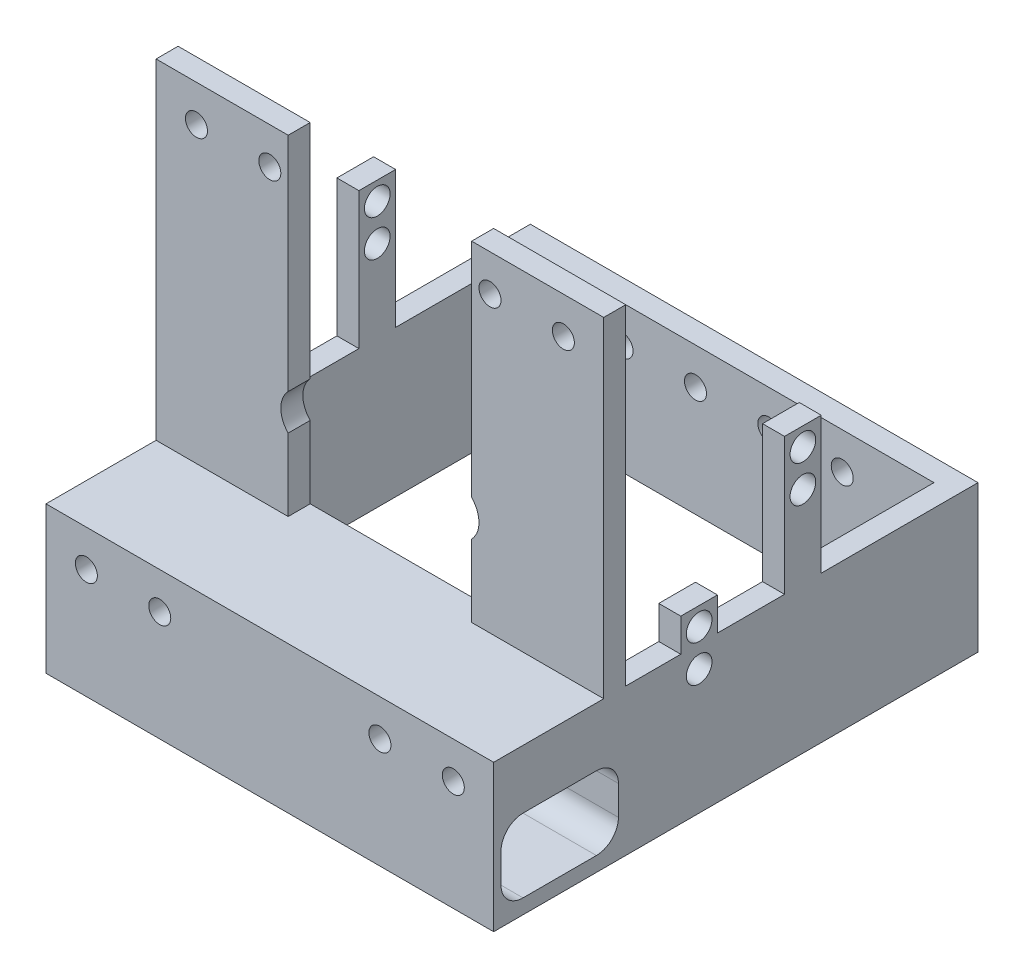
from build123d import *
from build123d.topology import SkipClean

# Parameters (mm, degrees)
SKETCH1_W           = 55
SKETCH1_H           = 10
SKETCH1_R           = 1.5
BOSS_EXTRUDE1_DEPTH = 15
BOSS_EXTRUDE2_START = 3
SKETCH2_R           = 1.5
BOSS_EXTRUDE2_DEPTH = 3
SKETCH3_W           = 55
SKETCH3_H           = 18
BOSS_EXTRUDE3_DEPTH = 10
BOSS_EXTRUDE5_DEPTH = 3
BOSS_EXTRUDE6_DEPTH = 3
CUT_EXTRUDE2_DEPTH  = 84.492514635
SKETCH10_W          = 3
SKETCH10_H          = 20
BOSS_EXTRUDE7_DEPTH = 45
SKETCH11_R          = 1.75
CUT_EXTRUDE3_DEPTH  = 96.131487952
SKETCH12_W          = 5
SKETCH12_H          = 18.64
SKETCH12_R          = 1.75
SKETCH12_H_2        = 4.5
BOSS_EXTRUDE8_DEPTH = 3
BOSS_EXTRUDE9_START = 3
SKETCH13_W          = 61
SKETCH13_H          = 20
SKETCH13_R          = 1.5
BOSS_EXTRUDE9_DEPTH = 3


with BuildPart() as part:
    # Sketch1 → Boss-Extrude1 (new body)
    with BuildSketch(Plane.XY):
        with Locations((-27.5, 5)):
            Rectangle(SKETCH1_W, SKETCH1_H)
        with Locations((-2.5, 5)):
            Circle(SKETCH1_R, mode=Mode.SUBTRACT)
        with Locations((-12.5, 5)):
            Circle(SKETCH1_R, mode=Mode.SUBTRACT)
        with Locations((-42.5, 5)):
            Circle(SKETCH1_R, mode=Mode.SUBTRACT)
        with Locations((-52.5, 5)):
            Circle(SKETCH1_R, mode=Mode.SUBTRACT)
    extrude(amount=BOSS_EXTRUDE1_DEPTH)

    # Sketch2 → Boss-Extrude2 (add)
    with SkipClean():  # the faces are left unmerged after this step: merging them gives an invalid solid
        with BuildSketch(Plane(origin=(0, 0, 0), x_dir=(-1, 0, 0), z_dir=(0, 0, -1)).offset(BOSS_EXTRUDE2_START)):
            with BuildLine():
                Line((0, 0), (55, 0))
                Line((55, 0), (55, 55))
                Line((55, 55), (40, 55))
                Line((40, 55), (40, 24.74951996))
                ThreePointArc((40, 24.74951996), (41, 22.300030217), (40, 19.850540474))
                Line((40, 19.850540474), (40, 10))
                Line((40, 10), (15, 10))
                Line((15, 10), (15, 19.850540474))
                ThreePointArc((15, 19.850540474), (14, 22.300030217), (15, 24.74951996))
                Line((15, 24.74951996), (15, 55))
                Line((15, 55), (0, 55))
                Line((0, 55), (0, 0))
            make_face()
            with Locations((2.5, 5)):
                Circle(SKETCH2_R, mode=Mode.SUBTRACT)
            with Locations((12.5, 5)):
                Circle(SKETCH2_R, mode=Mode.SUBTRACT)
            with Locations((12.5, 50)):
                Circle(SKETCH2_R, mode=Mode.SUBTRACT)
            with Locations((2.5, 50)):
                Circle(SKETCH2_R, mode=Mode.SUBTRACT)
            with Locations((52.5, 5)):
                Circle(SKETCH2_R, mode=Mode.SUBTRACT)
            with Locations((42.5, 5)):
                Circle(SKETCH2_R, mode=Mode.SUBTRACT)
            with Locations((52.5, 50)):
                Circle(SKETCH2_R, mode=Mode.SUBTRACT)
            with Locations((42.5, 50)):
                Circle(SKETCH2_R, mode=Mode.SUBTRACT)
        extrude(amount=-BOSS_EXTRUDE2_DEPTH)

    # Sketch3 → Boss-Extrude3 (add)
    with SkipClean():  # the faces are left unmerged after this step: merging them gives an invalid solid
        with BuildSketch(Plane.XZ):
            with Locations((-27.5, 6)):
                Rectangle(SKETCH3_W, SKETCH3_H)
        extrude(amount=BOSS_EXTRUDE3_DEPTH)

    # Sketch6 → Boss-Extrude5 (add)
    with SkipClean():  # the faces are left unmerged after this step: merging them gives an invalid solid
        with BuildSketch(Plane(origin=(0, 0, 0), x_dir=(0, 0, -1), z_dir=(1, 0, 0))):
            Polygon((-15, 10), (-15, -10), (3, -10), (3, 55), (0, 55), (0, 10), align=None)
        extrude(amount=BOSS_EXTRUDE5_DEPTH)

    # Sketch8 → Boss-Extrude6 (add)
    with SkipClean():  # the faces are left unmerged after this step: merging them gives an invalid solid
        with BuildSketch(Plane.ZY.offset(55)):
            Polygon((15, 10), (0, 10), (0, 55), (-3, 55), (-3, -10), (15, -10), align=None)
        extrude(amount=BOSS_EXTRUDE6_DEPTH)

    # Sketch9 → Cut-Extrude2 (cut, through all)
    with SkipClean():  # the faces are left unmerged after this step: merging them gives an invalid solid
        with BuildSketch(Plane.ZY.offset(58)):
            with BuildLine():
                Line((1, -8), (11, -8))
                ThreePointArc((11, -8), (13.121320344, -7.121320344), (14, -5))
                Line((14, -5), (14, -1))
                ThreePointArc((14, -1), (13.121320344, 1.121320344), (11, 2))
                Line((11, 2), (1, 2))
                ThreePointArc((1, 2), (-1.121320344, 1.121320344), (-2, -1))
                Line((-2, -1), (-2, -5))
                ThreePointArc((-2, -5), (-1.121320344, -7.121320344), (1, -8))
            make_face()
        extrude(amount=-CUT_EXTRUDE2_DEPTH, mode=Mode.SUBTRACT)

    # Sketch10 → Boss-Extrude7 (add)
    with SkipClean():  # the faces are left unmerged after this step: merging them gives an invalid solid
        with BuildSketch(Plane(origin=(0, 0, -3), x_dir=(-1, 0, 0), z_dir=(0, 0, -1))):
            with Locations((56.5, 0)):
                Rectangle(SKETCH10_W, SKETCH10_H)
            with Locations((-1.5, 0)):
                Rectangle(SKETCH10_W, SKETCH10_H)
        extrude(amount=BOSS_EXTRUDE7_DEPTH)

    # Sketch11 → Cut-Extrude3 (cut, through all)
    with SkipClean():  # the faces are left unmerged after this step: merging them gives an invalid solid
        with BuildSketch(Plane.ZY.offset(58)):
            with Locations((-13, 7)):
                Circle(SKETCH11_R)
        extrude(amount=-CUT_EXTRUDE3_DEPTH, mode=Mode.SUBTRACT)

    # Sketch12 → Boss-Extrude8 (add)
    # profile 1 of 2: a face of its own
    with SkipClean():  # the faces are left unmerged after this step: merging them gives an invalid solid
        with BuildSketch(Plane.ZY.offset(58)):
            with Locations((-27.14, 19.32)):
                Rectangle(SKETCH12_W, SKETCH12_H)
            with Locations((-27.14, 26.14)):
                Circle(SKETCH12_R, mode=Mode.SUBTRACT)
            with Locations((-27.14, 21.14)):
                Circle(SKETCH12_R, mode=Mode.SUBTRACT)
        # profile 2 of 2: a face of its own
        with BuildSketch(Plane.ZY.offset(58)):
            with Locations((-13, 12.25)):
                Rectangle(SKETCH12_W, SKETCH12_H_2)
            with Locations((-13, 12)):
                Circle(SKETCH12_R, mode=Mode.SUBTRACT)
        boss_extrude8 = extrude(amount=-BOSS_EXTRUDE8_DEPTH)

    # Mirror1: Boss-Extrude8 across plane
    with SkipClean():  # the faces are left unmerged after this step: merging them gives an invalid solid
        add(boss_extrude8.mirror(Plane.ZY.offset(27.5)))

    # Sketch13 → Boss-Extrude9 (add)
    with SkipClean():  # the faces are left unmerged after this step: merging them gives an invalid solid
        with BuildSketch(Plane(origin=(0, 0, -48), x_dir=(-1, 0, 0), z_dir=(0, 0, -1)).offset(BOSS_EXTRUDE9_START)):
            with Locations((27.5, 0)):
                Rectangle(SKETCH13_W, SKETCH13_H)
            with Locations((22.5, 5)):
                Circle(SKETCH13_R, mode=Mode.SUBTRACT)
            with Locations((12.5, 5)):
                Circle(SKETCH13_R, mode=Mode.SUBTRACT)
            with Locations((2.5, 5)):
                Circle(SKETCH13_R, mode=Mode.SUBTRACT)
            with Locations((52.5, 5)):
                Circle(SKETCH13_R, mode=Mode.SUBTRACT)
            with Locations((42.5, 5)):
                Circle(SKETCH13_R, mode=Mode.SUBTRACT)
            with Locations((32.5, 5)):
                Circle(SKETCH13_R, mode=Mode.SUBTRACT)
        extrude(amount=-BOSS_EXTRUDE9_DEPTH)


solid = part.part
